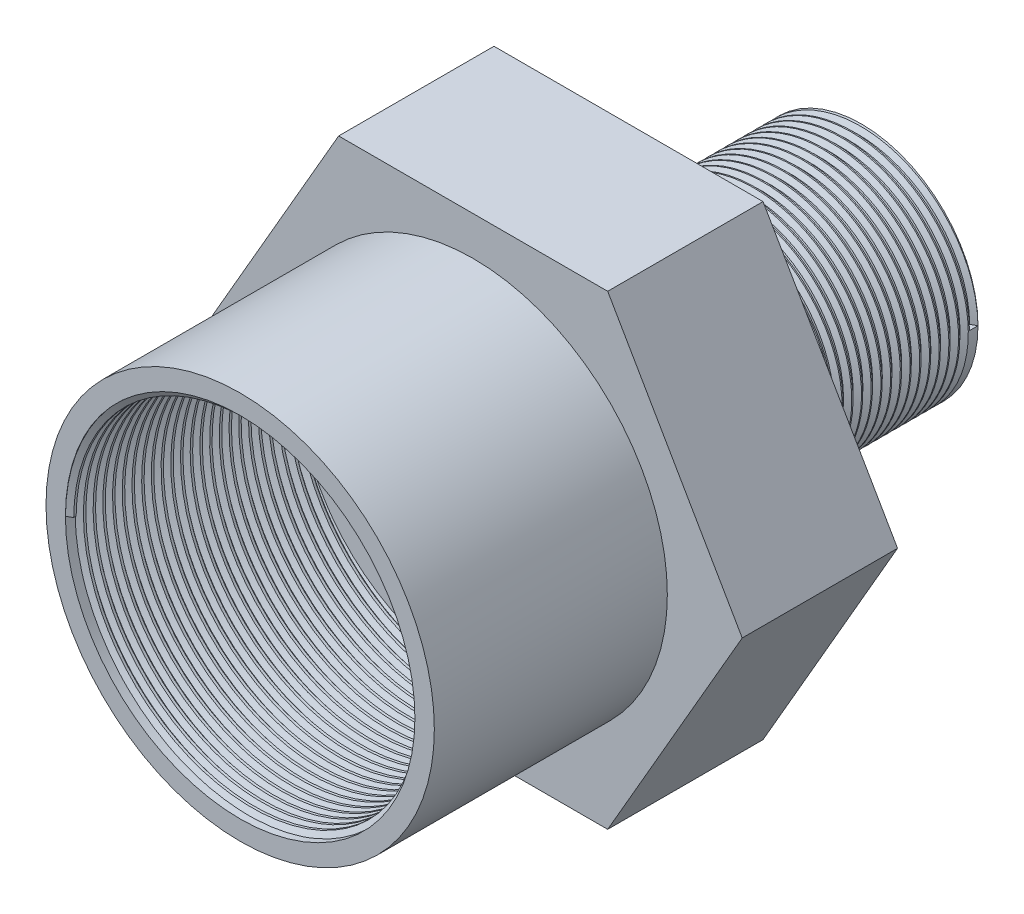
from build123d import *

# Parameters (mm, degrees)
BOSS_EXTRUDE1_DEPTH = 20
SKETCH2_R           = 25
SKETCH2_R_2         = 22.5
BOSS_EXTRUDE2_DEPTH = 30
SKETCH3_R           = 15
SKETCH3_R_2         = 12.5
BOSS_EXTRUDE3_DEPTH = 30
THREAD1_PITCH       = 1.25
THREAD3_PITCH       = 1.25


with BuildPart() as part:
    # Sketch1 → Boss-Extrude1 (new body)
    with BuildSketch(Plane.XY):
        Polygon((34.641016151, 0), (17.320508076, 30), (-17.320508076, 30), (-34.641016151, 0), (-17.320508076, -30), (17.320508076, -30), align=None)
    extrude(amount=BOSS_EXTRUDE1_DEPTH)

    # Sketch2 → Boss-Extrude2 (add)
    with BuildSketch(Plane.XY.offset(20)):
        Circle(SKETCH2_R)
        Circle(SKETCH2_R_2, mode=Mode.SUBTRACT)
    extrude(amount=BOSS_EXTRUDE2_DEPTH)

    # Sketch3 → Boss-Extrude3 (add)
    with BuildSketch(Plane(origin=(0, 0, 0), x_dir=(-1, 0, 0), z_dir=(0, 0, -1))):
        with Locations(Location((0, 0, 0), (0, 0, 180))):
            Circle(SKETCH3_R)
        Circle(SKETCH3_R_2, mode=Mode.SUBTRACT)
    extrude(amount=BOSS_EXTRUDE3_DEPTH)

    # Thread1: the profile of Thread Profile1 profile screwed along a right-hand helix of 24 turns, 8 arcs to a turn; built about Z, then put on its axis
    thread1_z = Axis((0, 0, 0), (0, 0, 1))
    thread1_corners = [(22.5003, 0, -0.000173205), (22.5003, 0, 1.093923202), (21.823417656, 0, 0.703124998), (21.823417656, 0, 0.390624998)]
    with BuildLine(mode=Mode.PRIVATE) as thread1_profile:
        Line(thread1_corners[0], thread1_corners[1])
        Line(thread1_corners[1], thread1_corners[2])
        Line(thread1_corners[2], thread1_corners[3])
        Line(thread1_corners[3], thread1_corners[0])
    thread1_cap = Face(thread1_profile.wire())
    thread1_turn_angles = [0, 22.5, 45, 67.5, 90, 112.5, 135, 157.5, 180, 202.5, 225, 247.5, 270, 292.5, 315, 337.5, 360]
    thread1_turn_weights = [1, 0.9238795325112867, 1, 0.9238795325112867, 1, 0.9238795325112867, 1, 0.9238795325112867, 1, 0.9238795325112867, 1, 0.9238795325112867, 1, 0.9238795325112867, 1, 0.9238795325112867, 1]
    thread1_turn_rails = [Edge.make_bspline([Vector(p[0], p[1], 0).rotate(thread1_z, thread1_turn_angles[k]) / thread1_turn_weights[k] + Vector(0, 0, p[2] + THREAD1_PITCH * thread1_turn_angles[k] / 360) for k in range(17)], [0, 0, 0, 1, 1, 2, 2, 3, 3, 4, 4, 5, 5, 6, 6, 7, 7, 8, 8, 8], 2, thread1_turn_weights) for p in thread1_corners]
    thread1_turn_sides = [Face.make_surface_from_curves(thread1_turn_rails[p[0]], thread1_turn_rails[p[1]]) for p in [(0, 1), (1, 2), (2, 3), (3, 0)]]
    thread1 = Plane(origin=(0, 0, 50), x_dir=(-1, 0, 0), z_dir=(0, 0, -1)) * Solid(Shell([*[p.moved(Location((0, 0, THREAD1_PITCH * i))) for i in range(24) for p in thread1_turn_sides], thread1_cap, thread1_cap.rotate(thread1_z, 8640).moved(Location((0, 0, THREAD1_PITCH * 8640 / 360)))]))
    add(thread1)

    # Thread3: the profile of Thread Profile3 profile screwed along a right-hand helix of 24 turns, 8 arcs to a turn; built about Z, then put on its axis
    thread3_z = Axis((0, 0, 0), (0, 0, 1))
    thread3_corners = [(15.0003, 0, -0.000173205), (15.0003, 0, 1.093923202), (14.323417656, 0, 0.703124998), (14.323417656, 0, 0.390624998)]
    with BuildLine(mode=Mode.PRIVATE) as thread3_profile:
        Line(thread3_corners[0], thread3_corners[1])
        Line(thread3_corners[1], thread3_corners[2])
        Line(thread3_corners[2], thread3_corners[3])
        Line(thread3_corners[3], thread3_corners[0])
    thread3_cap = Face(thread3_profile.wire())
    thread3_turn_angles = [0, 22.5, 45, 67.5, 90, 112.5, 135, 157.5, 180, 202.5, 225, 247.5, 270, 292.5, 315, 337.5, 360]
    thread3_turn_weights = [1, 0.9238795325112867, 1, 0.9238795325112867, 1, 0.9238795325112867, 1, 0.9238795325112867, 1, 0.9238795325112867, 1, 0.9238795325112867, 1, 0.9238795325112867, 1, 0.9238795325112867, 1]
    thread3_turn_rails = [Edge.make_bspline([Vector(p[0], p[1], 0).rotate(thread3_z, thread3_turn_angles[k]) / thread3_turn_weights[k] + Vector(0, 0, p[2] + THREAD3_PITCH * thread3_turn_angles[k] / 360) for k in range(17)], [0, 0, 0, 1, 1, 2, 2, 3, 3, 4, 4, 5, 5, 6, 6, 7, 7, 8, 8, 8], 2, thread3_turn_weights) for p in thread3_corners]
    thread3_turn_sides = [Face.make_surface_from_curves(thread3_turn_rails[p[0]], thread3_turn_rails[p[1]]) for p in [(0, 1), (1, 2), (2, 3), (3, 0)]]
    thread3 = Plane(origin=(0, 0, -30), x_dir=(1, 0, 0), z_dir=(0, 0, 1)) * Solid(Shell([*[p.moved(Location((0, 0, THREAD3_PITCH * i))) for i in range(24) for p in thread3_turn_sides], thread3_cap, thread3_cap.rotate(thread3_z, 8640).moved(Location((0, 0, THREAD3_PITCH * 8640 / 360)))]))
    add(thread3, mode=Mode.SUBTRACT)


solid = part.part
